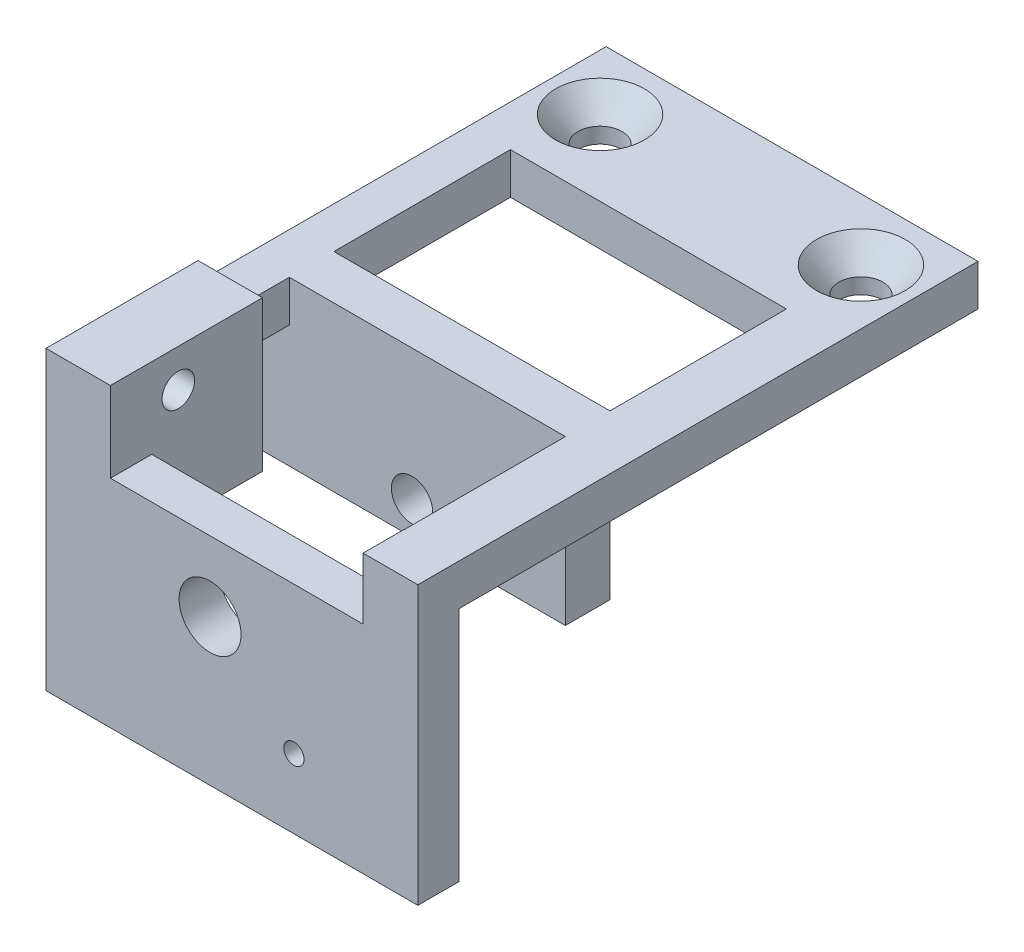
from build123d import *

# Parameters (mm, degrees)
SKETCH1_R                                        = 1.561475409
SKETCH1_R_2                                      = 4.762499999
BOSS_EXTRUDE1_DEPTH                              = 6.35
BOSS_EXTRUDE2_DEPTH                              = 23.368
SKETCH3_W                                        = 6.35
SKETCH3_H                                        = 78.34
SKETCH3_W_2                                      = 8.382
BOSS_EXTRUDE3_DEPTH                              = 6.35
CUT_EXTRUDE1_REACH                               = 104.101
SKETCH4_R                                        = 2.5
BOSS_EXTRUDE4_DEPTH                              = 6.35
CSK_FOR_1_4_FLAT_HEAD_MACHINE_SCREW1_D           = 6.7564
CSK_FOR_1_4_FLAT_HEAD_MACHINE_SCREW1_CSINK_D     = 13.6398
CSK_FOR_1_4_FLAT_HEAD_MACHINE_SCREW1_CSINK_ANGLE = 82
SKETCH8_W                                        = 48.768
SKETCH8_H                                        = 6.843039895
BOSS_EXTRUDE5_DEPTH                              = 25.146
CUT_EXTRUDE2_REACH                               = 68.059
SKETCH10_R                                       = 3.175


with BuildPart() as part:
    # Sketch1 → Boss-Extrude1 (new body)
    with BuildSketch(Plane.XY):
        Polygon((23.52260518, 29.069744957), (31.942128684, 29.069744957), (31.942128684, -13.602255043), (-25.207871316, -13.602255043), (-25.207871316, 8.844196721), (-25.207871316, 31.958196721), (-18.857871316, 31.958196721), (-15.310946905, 31.958196721), (-15.310946905, 22.656471706), (-15.310946905, 19.620299994), (23.52260518, 19.620299994), (23.52260518, 22.656471706), align=None)
        with Locations((12.892128684, -2.934255043)):
            Circle(SKETCH1_R, mode=Mode.SUBTRACT)
        with Locations((6.7e-08, 8.844196721)):
            Circle(SKETCH1_R_2, mode=Mode.SUBTRACT)
    extrude(amount=-BOSS_EXTRUDE1_DEPTH)

    # Sketch2 → Boss-Extrude2 (add)
    with BuildSketch(Plane.XY):
        Polygon((-15.310946905, 31.958196721), (-18.857871316, 31.958196721), (-25.207871316, 31.958196721), (-25.207871316, 8.844196721), (-18.857871316, 8.844196721), (-15.310946905, 8.844196721), (-15.310946905, 19.620299994), align=None)
    extrude(amount=-BOSS_EXTRUDE2_DEPTH)

    # Sketch3 → Boss-Extrude3 (add)
    with BuildSketch(Plane(origin=(0, 29.069744957, 0), x_dir=(1, 0, 0), z_dir=(0, 1, 0))):
        with Locations((-22.032871316, 39.17)):
            Rectangle(SKETCH3_W, SKETCH3_H)
        with Locations((27.751128684, 39.17)):
            Rectangle(SKETCH3_W_2, SKETCH3_H)
    extrude(amount=-BOSS_EXTRUDE3_DEPTH)

    # Sketch4 → Cut-Extrude1 (cut, up to next)
    with BuildSketch(Plane.ZY.offset(25.207871316), mode=Mode.PRIVATE) as cut_extrude1_sk1:
        with Locations((-10.437499124, 26.162307082)):
            Circle(SKETCH4_R)
    cut_extrude1_tool1 = extrude(cut_extrude1_sk1.sketch, amount=-CUT_EXTRUDE1_REACH, mode=Mode.PRIVATE) & part.part
    add(cut_extrude1_tool1.solids().sort_by_distance((-25.207871, 26.162307, -10.437499))[0], mode=Mode.SUBTRACT)

    # Sketch5 → Boss-Extrude4 (add)
    with BuildSketch(Plane(origin=(0, 29.069744957, 0), x_dir=(1, 0, 0), z_dir=(0, 1, 0))):
        Polygon((-25.207871316, 78.34), (-25.207871316, 65.022649662), (31.942128684, 65.022649662), (31.942128684, 78.34), (31.942128684, 86.081334737), (-25.207871316, 86.081334737), align=None)
    extrude(amount=-BOSS_EXTRUDE4_DEPTH)

    # CSK for 1/4 Flat Head Machine Screw1 (through all)
    with Locations(Plane(origin=(0, 29.069744957, 0), x_dir=(1, 0, 0), z_dir=(0, 1, 0))):
        with Locations((-16.661056486, 76.596548484), (23.434720161, 76.596548484)):
            CounterSinkHole(CSK_FOR_1_4_FLAT_HEAD_MACHINE_SCREW1_D / 2, CSK_FOR_1_4_FLAT_HEAD_MACHINE_SCREW1_CSINK_D / 2, counter_sink_angle=CSK_FOR_1_4_FLAT_HEAD_MACHINE_SCREW1_CSINK_ANGLE)

    # Sketch8 → Boss-Extrude5 (add)
    with BuildSketch(Plane(origin=(0, 29.069744957, 0), x_dir=(1, 0, 0), z_dir=(0, 1, 0))):
        with Locations((-0.823871316, 34.471519947)):
            Rectangle(SKETCH8_W, SKETCH8_H)
    extrude(amount=-BOSS_EXTRUDE5_DEPTH)

    # Sketch10 → Cut-Extrude2 (cut, up to next)
    with BuildSketch(Plane(origin=(0, 0, -37.893039895), x_dir=(-1, 0, 0), z_dir=(0, 0, -1)), mode=Mode.PRIVATE) as cut_extrude2_sk1:
        with Locations((-6.7e-08, 8.844196721)):
            Circle(SKETCH10_R)
    cut_extrude2_tool1 = extrude(cut_extrude2_sk1.sketch, amount=-CUT_EXTRUDE2_REACH, mode=Mode.PRIVATE) & part.part
    add(cut_extrude2_tool1.solids().sort_by_distance((0, 8.844197, -37.89304))[0], mode=Mode.SUBTRACT)


solid = part.part
